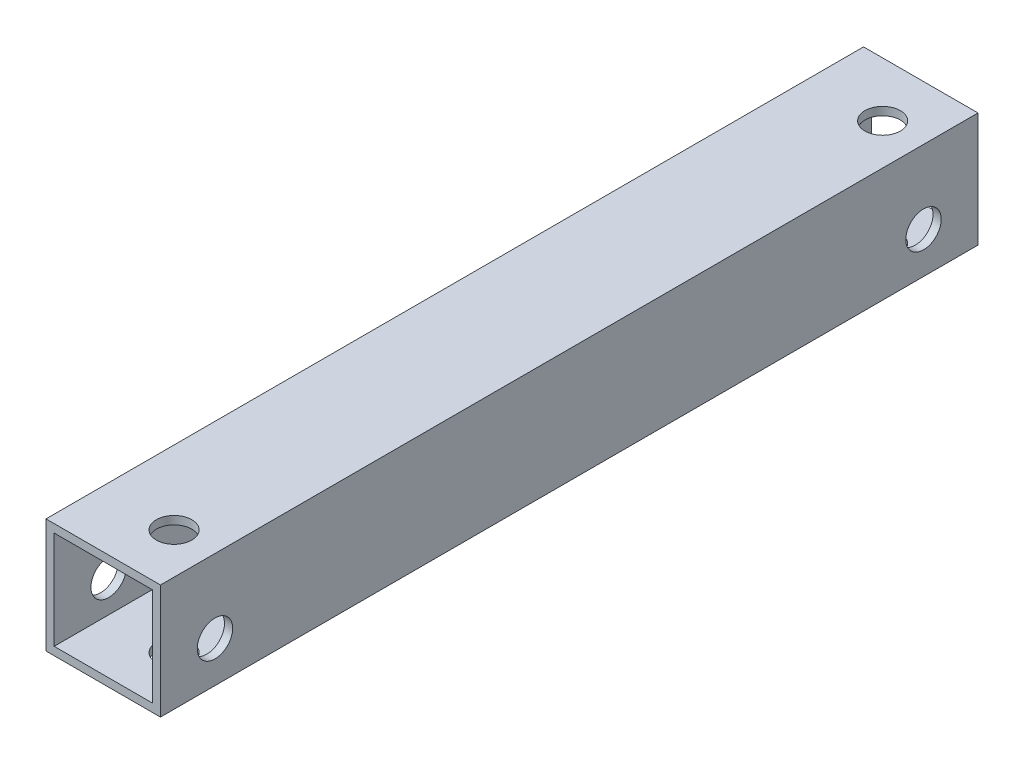
from build123d import *

# Parameters (mm, degrees)
CROQUIS1_W              = 42
CROQUIS1_H              = 42
CROQUIS1_W_2            = 36
CROQUIS1_H_2            = 36
SALIENTE_EXTRUIR1_DEPTH = 150
CROQUIS2_R              = 6.5
CORTAR_EXTRUIR1_DEPTH   = 300
CROQUIS3_R              = 6.5
CORTAR_EXTRUIR2_DEPTH   = 158.178242769


with BuildPart() as part:
    # Croquis1 → Saliente-Extruir1 (new, symmetric)
    with BuildSketch(Plane.XY):
        Rectangle(CROQUIS1_W, CROQUIS1_H)
        Rectangle(CROQUIS1_W_2, CROQUIS1_H_2, mode=Mode.SUBTRACT)
    extrude(amount=SALIENTE_EXTRUIR1_DEPTH, both=True)

    # Croquis2 → Cortar-Extruir1 (cut)
    with BuildSketch(Plane(origin=(21, 0, 0), x_dir=(0, 0, -1), z_dir=(1, 0, 0))):
        with Locations((-130, -6)):
            Circle(CROQUIS2_R)
        with Locations((130, -6)):
            Circle(CROQUIS2_R)
    extrude(amount=-CORTAR_EXTRUIR1_DEPTH, mode=Mode.SUBTRACT)

    # Croquis3 → Cortar-Extruir2 (cut, through all)
    with BuildSketch(Plane.XZ.offset(21)):
        with Locations((6, -130)):
            Circle(CROQUIS3_R)
        with Locations((6, 130)):
            Circle(CROQUIS3_R)
    extrude(amount=-CORTAR_EXTRUIR2_DEPTH, mode=Mode.SUBTRACT)


solid = part.part
